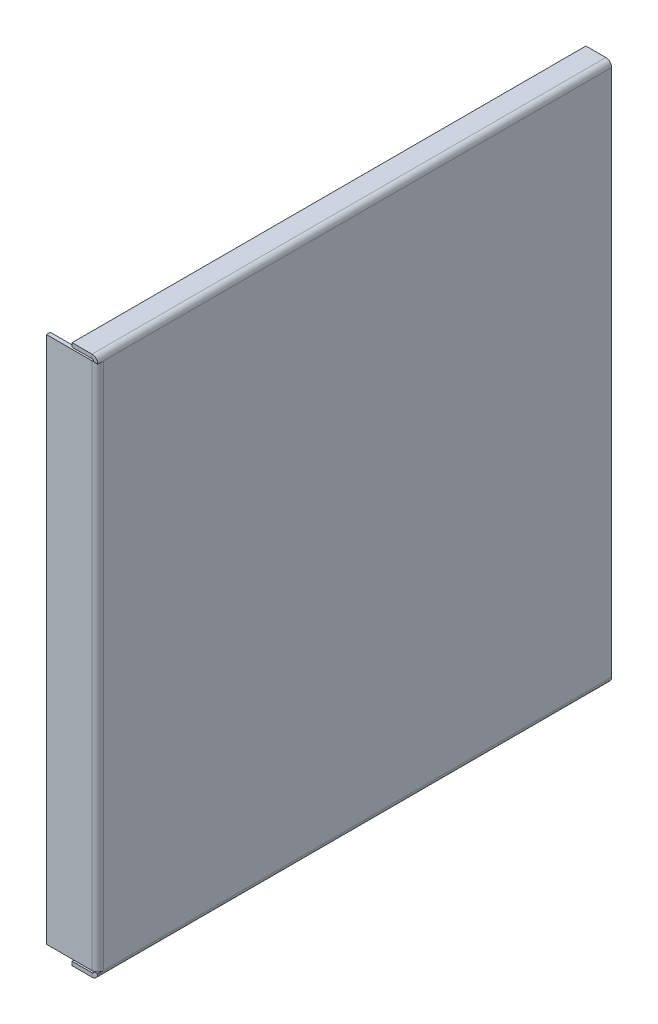
from build123d import *

# Parameters (mm, degrees)
SKETCH_2_W                       = 1.5
SKETCH_2_H                       = 210
SM_BASE_FLANGE_1_DEPTH           = 200
SM_EDGE_FLANGE_1_STRIP_W         = 7.4732
SM_EDGE_FLANGE_1_STRIP_H         = 1.5
SM_EDGE_FLANGE_1_STRIP_CUT_DEPTH = 200
SM_EDGE_FLANGE_1_DEPTH           = 200
SM_EDGE_FLANGE_2_STRIP_W         = 7.4732
SM_EDGE_FLANGE_2_STRIP_H         = 1.5
SM_EDGE_FLANGE_2_STRIP_CUT_DEPTH = 200
SM_EDGE_FLANGE_2_DEPTH           = 200
SM_EDGE_FLANGE_3_STRIP_W         = 7.4732
SM_EDGE_FLANGE_3_STRIP_H         = 1.5
SM_EDGE_FLANGE_3_STRIP_CUT_DEPTH = 205.5268
SM_EDGE_FLANGE_3_DEPTH           = 205.5268


# Sheet-metal steps are written as plain solids
with BuildPart() as part:
    # Sketch 2 → 基体-法兰1 (new body)
    with BuildSketch(Plane.XY):
        with Locations((0.75, 105)):
            Rectangle(SKETCH_2_W, SKETCH_2_H)
    extrude(amount=SM_BASE_FLANGE_1_DEPTH)

    # 边线-法兰1 strip (across the edge) → 边线-法兰1 strip cut (cut)
    with BuildSketch(Plane(origin=(0, 210, 200), x_dir=(0, -1, 0), z_dir=(0, 0, -1))):
        with Locations((-1.5, -0.75)):
            Rectangle(SM_EDGE_FLANGE_1_STRIP_W, SM_EDGE_FLANGE_1_STRIP_H)
    extrude(amount=SM_EDGE_FLANGE_1_STRIP_CUT_DEPTH, mode=Mode.SUBTRACT)

    # 边线-法兰1 section (across the edge) → 边线-法兰1 (add)
    with BuildSketch(Plane(origin=(0, 210, 200), x_dir=(0, -1, 0), z_dir=(0, 0, -1))):
        with BuildLine():
            Line((0, 0.7366), (0, 8.5))
            Line((0, 8.5), (1.5, 8.5))
            Line((1.5, 8.5), (1.5, 0.7366))
            ThreePointArc((1.5, 0.7366), (1.715745145, 0.215745145), (2.2366, 0))
            Line((2.2366, 0), (2.2366, -1.5))
            ThreePointArc((2.2366, -1.5), (0.655084973, -0.844915027), (0, 0.7366))
        make_face()
    extrude(amount=SM_EDGE_FLANGE_1_DEPTH)

    # 边线-法兰2 strip (across the edge) → 边线-法兰2 strip cut (cut)
    with BuildSketch(Plane(origin=(0, 0, 0), x_dir=(0, 1, 0), z_dir=(0, 0, 1))):
        with Locations((-1.5, -0.75)):
            Rectangle(SM_EDGE_FLANGE_2_STRIP_W, SM_EDGE_FLANGE_2_STRIP_H)
    extrude(amount=SM_EDGE_FLANGE_2_STRIP_CUT_DEPTH, mode=Mode.SUBTRACT)

    # 边线-法兰2 section (across the edge) → 边线-法兰2 (add)
    with BuildSketch(Plane(origin=(0, 0, 0), x_dir=(0, 1, 0), z_dir=(0, 0, 1))):
        with BuildLine():
            Line((0, 0.7366), (0, 8.5))
            Line((0, 8.5), (1.5, 8.5))
            Line((1.5, 8.5), (1.5, 0.7366))
            ThreePointArc((1.5, 0.7366), (1.715745145, 0.215745145), (2.2366, 0))
            Line((2.2366, 0), (2.2366, -1.5))
            ThreePointArc((2.2366, -1.5), (0.655084973, -0.844915027), (0, 0.7366))
        make_face()
    extrude(amount=SM_EDGE_FLANGE_2_DEPTH)

    # 边线-法兰3 strip (across the edge) → 边线-法兰3 strip cut (cut)
    with BuildSketch(Plane(origin=(0, 2.2366, 200), x_dir=(0, 0, -1), z_dir=(0, 1, 0))):
        with Locations((-1.5, -0.75)):
            Rectangle(SM_EDGE_FLANGE_3_STRIP_W, SM_EDGE_FLANGE_3_STRIP_H)
    extrude(amount=SM_EDGE_FLANGE_3_STRIP_CUT_DEPTH, mode=Mode.SUBTRACT)

    # 边线-法兰3 section (across the edge) → 边线-法兰3 (add)
    with BuildSketch(Plane(origin=(0, 2.2366, 200), x_dir=(0, 0, -1), z_dir=(0, 1, 0))):
        with BuildLine():
            Line((0, 0.7366), (0, 18.5))
            Line((0, 18.5), (1.5, 18.5))
            Line((1.5, 18.5), (1.5, 0.7366))
            ThreePointArc((1.5, 0.7366), (1.715745145, 0.215745145), (2.2366, 0))
            Line((2.2366, 0), (2.2366, -1.5))
            ThreePointArc((2.2366, -1.5), (0.655084973, -0.844915027), (0, 0.7366))
        make_face()
    extrude(amount=SM_EDGE_FLANGE_3_DEPTH)


solid = part.part
